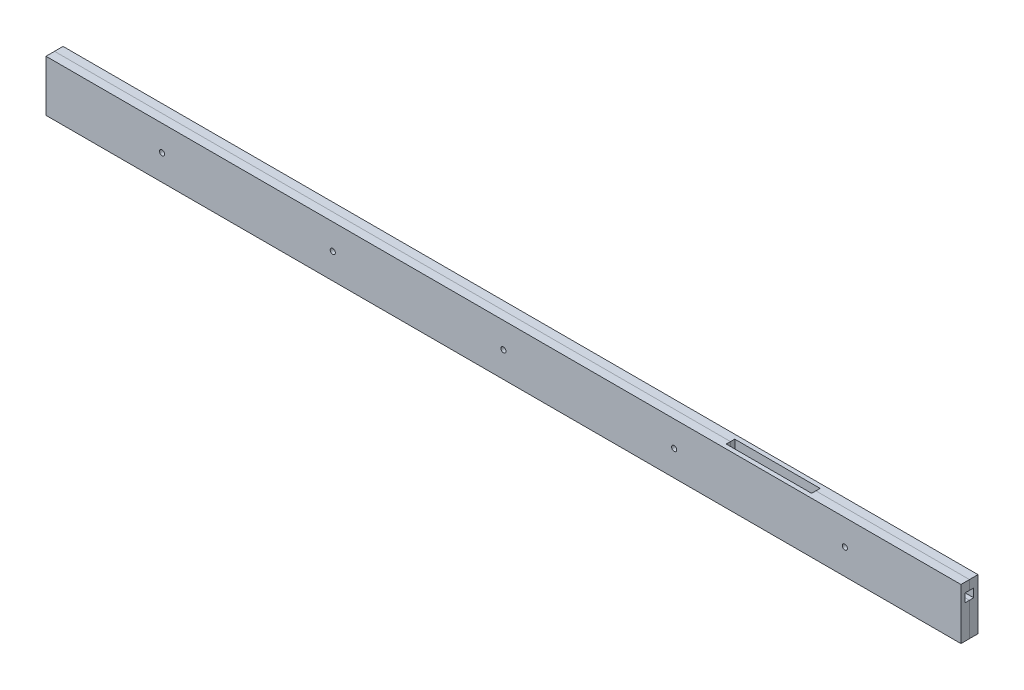
from build123d import *

# Parameters (mm, degrees)
SKETCH_1_W                         = 1072
SKETCH_1_H                         = 60
EXTRUDE_1_DEPTH                    = 5
CUT_EXTRUDE_1_DEPTH                = 5
SKETCH_3_R                         = 3
CUT_EXTRUDE_2_DEPTH                = 537.932025493
CHAMFER_1_SIZE                     = 2
PATTERN_LINEAR_1_COUNT             = 5
PATTERN_LINEAR_1_PITCH             = 200
CHAMFER_1_OF_PATTERN_LINEAR_1_SIZE = 2


with BuildPart() as part:
    # Эскиз1 → Бобышка-Вытянуть1 (new, symmetric)
    with BuildSketch(Plane.XY):
        Rectangle(SKETCH_1_W, SKETCH_1_H)
    extrude(amount=EXTRUDE_1_DEPTH, both=True)

    # Эскиз2 → Вырез-Вытянуть1 (cut)
    with BuildSketch(Plane.XY.offset(5)):
        with BuildLine():
            Line((-291, 19), (256, 19))
            Line((256, 19), (256, 30))
            Line((256, 30), (356, 30))
            Line((356, 30), (356, 19))
            Line((356, 19), (536, 19))
            Line((536, 19), (536, 9))
            Line((536, 9), (356, 9))
            Line((356, 9), (356, -30))
            Line((356, -30), (256, -30))
            Line((256, -30), (256, 9))
            Line((256, 9), (-291, 9))
            ThreePointArc((-291, 9), (-296, 14), (-291, 19))
        make_face()
    extrude(amount=-CUT_EXTRUDE_1_DEPTH, mode=Mode.SUBTRACT)

    # Эскиз3 → Вырез-Вытянуть2 (cut, through all)
    with BuildSketch(Plane.XY.offset(5)):
        with Locations((400, 0)):
            Circle(SKETCH_3_R)
    cut_extrude_2 = extrude(amount=-CUT_EXTRUDE_2_DEPTH, mode=Mode.SUBTRACT)

    # Фаска1
    chamfer_1_edges = [part.edges().sort_by_distance(p)[0] for p in [
        (397, 0, 5),
    ]]
    chamfer(chamfer_1_edges, length=CHAMFER_1_SIZE)

    # Линейный массив1: Вырез-Вытянуть2 ×5
    with Locations(*[(-i * PATTERN_LINEAR_1_PITCH, 0, 0) for i in range(1, PATTERN_LINEAR_1_COUNT)]):
        add(cut_extrude_2, mode=Mode.SUBTRACT)

    # Фаска1 of Линейный массив1
    chamfer_1_of_pattern_linear_1_edges = [part.edges().sort_by_distance(p)[0] for p in [
        (197, 0, 5),
        (-3, 0, 5),
        (-203, 0, 5),
        (-403, 0, 5),
    ]]
    chamfer(chamfer_1_of_pattern_linear_1_edges, length=CHAMFER_1_OF_PATTERN_LINEAR_1_SIZE)


with BuildPart() as body_2:
    # Зеркальное отражение1: mirrored copy
    add(part.part.mirror(Plane(origin=(0, 0, 5), x_dir=(1, 0, 0), z_dir=(0, 0, -1))))


solid = Compound([part.part, body_2.part])
